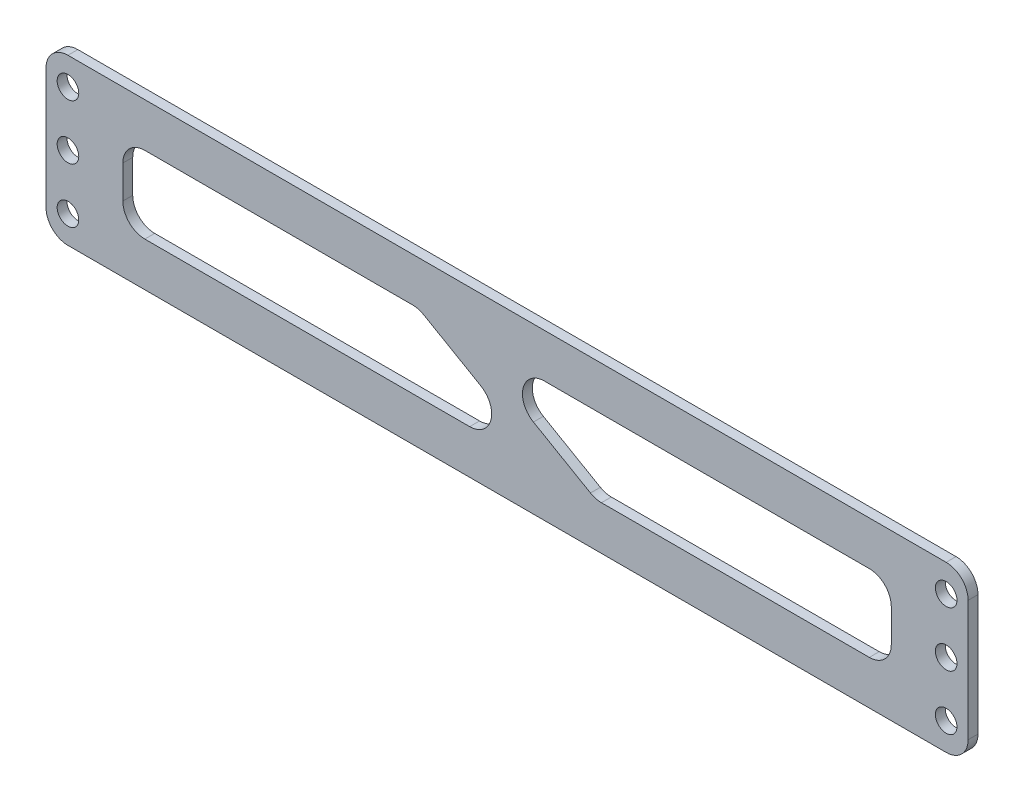
from build123d import *

# Parameters (mm, degrees)
SKETCH1_R           = 2.5
BOSS_EXTRUDE1_DEPTH = 2.286
CUT_EXTRUDE1_DEPTH  = 823.59169598
FILLET1_R           = 5.08


with BuildPart() as part:
    # Sketch1 → Boss-Extrude1 (new body)
    with BuildSketch(Plane.XY):
        with BuildLine():
            Line((-7.62, 755.65), (210.82, 755.65))
            ThreePointArc((210.82, 755.65), (214.412102448, 757.137897552), (215.9, 760.73))
            Line((215.9, 760.73), (215.9, 788.67))
            ThreePointArc((215.9, 788.67), (214.412102448, 792.262102448), (210.82, 793.75))
            Line((210.82, 793.75), (-7.62, 793.75))
            ThreePointArc((-7.62, 793.75), (-11.212102448, 792.262102448), (-12.7, 788.67))
            Line((-12.7, 788.67), (-12.7, 760.73))
            ThreePointArc((-12.7, 760.73), (-11.212102448, 757.137897552), (-7.62, 755.65))
        make_face()
        with Locations((0, 762)):
            Circle(SKETCH1_R, mode=Mode.SUBTRACT)
        with Locations((0, 774.7)):
            Circle(SKETCH1_R, mode=Mode.SUBTRACT)
        with Locations((0, 787.4)):
            Circle(SKETCH1_R, mode=Mode.SUBTRACT)
        with Locations((203.2, 762)):
            Circle(SKETCH1_R, mode=Mode.SUBTRACT)
        with Locations((203.2, 774.7)):
            Circle(SKETCH1_R, mode=Mode.SUBTRACT)
        with Locations((203.2, 787.4)):
            Circle(SKETCH1_R, mode=Mode.SUBTRACT)
        with BuildLine():
            Line((17.78, 783.59), (79.760886363, 783.59))
            ThreePointArc((79.760886363, 783.59), (81.075687113, 783.416903198), (82.300886363, 782.909409051))
            Line((82.300886363, 782.909409051), (95.499113517, 775.289409051))
            ThreePointArc((95.499113517, 775.289409051), (97.866016715, 769.575199251), (92.959113517, 765.81))
            Line((92.959113517, 765.81), (17.78, 765.81))
            ThreePointArc((17.78, 765.81), (14.187897552, 767.297897552), (12.7, 770.89))
            Line((12.7, 770.89), (12.7, 778.51))
            ThreePointArc((12.7, 778.51), (14.187897552, 782.102102448), (17.78, 783.59))
        make_face(mode=Mode.SUBTRACT)
        with BuildLine():
            Line((190.5, 778.51), (190.5, 770.89))
            ThreePointArc((190.5, 770.89), (189.012102448, 767.297897552), (185.42, 765.81))
            Line((185.42, 765.81), (123.439113517, 765.81))
            ThreePointArc((123.439113517, 765.81), (122.124312768, 765.983096802), (120.899113517, 766.490590949))
            Line((120.899113517, 766.490590949), (107.700886363, 774.110590949))
            ThreePointArc((107.700886363, 774.110590949), (105.333983166, 779.824800749), (110.240886363, 783.59))
            Line((110.240886363, 783.59), (185.42, 783.59))
            ThreePointArc((185.42, 783.59), (189.012102448, 782.102102448), (190.5, 778.51))
        make_face(mode=Mode.SUBTRACT)
    extrude(amount=BOSS_EXTRUDE1_DEPTH)

    # Sketch3 → Cut-Extrude1 (cut, through all)
    with BuildSketch(Plane(origin=(0, 0, 0), x_dir=(-1, 0, 0), z_dir=(0, 0, -1))):
        with BuildLine():
            Line((-210.82, 755.65), (-208.28, 755.65))
            Line((-208.28, 755.65), (-208.28, 793.75))
            Line((-208.28, 793.75), (-210.82, 793.75))
            ThreePointArc((-210.82, 793.75), (-214.412102448, 792.262102448), (-215.9, 788.67))
            Line((-215.9, 788.67), (-215.9, 760.73))
            ThreePointArc((-215.9, 760.73), (-214.412102448, 757.137897552), (-210.82, 755.65))
        make_face()
        with BuildLine():
            Line((5.08, 793.75), (5.08, 755.65))
            Line((5.08, 755.65), (7.62, 755.65))
            ThreePointArc((7.62, 755.65), (11.212102448, 757.137897552), (12.7, 760.73))
            Line((12.7, 760.73), (12.7, 788.67))
            ThreePointArc((12.7, 788.67), (11.212102448, 792.262102448), (7.62, 793.75))
            Line((7.62, 793.75), (5.08, 793.75))
        make_face()
    extrude(amount=-CUT_EXTRUDE1_DEPTH, mode=Mode.SUBTRACT)

    # Fillet1
    fillet1_edges = [part.edges().sort_by_distance(p)[0] for p in [
        (-5.08, 755.65, 1.143),
        (-5.08, 793.75, 1.143),
        (208.28, 755.65, 1.143),
        (208.28, 793.75, 1.143),
    ]]
    fillet(fillet1_edges, radius=FILLET1_R)


solid = part.part
